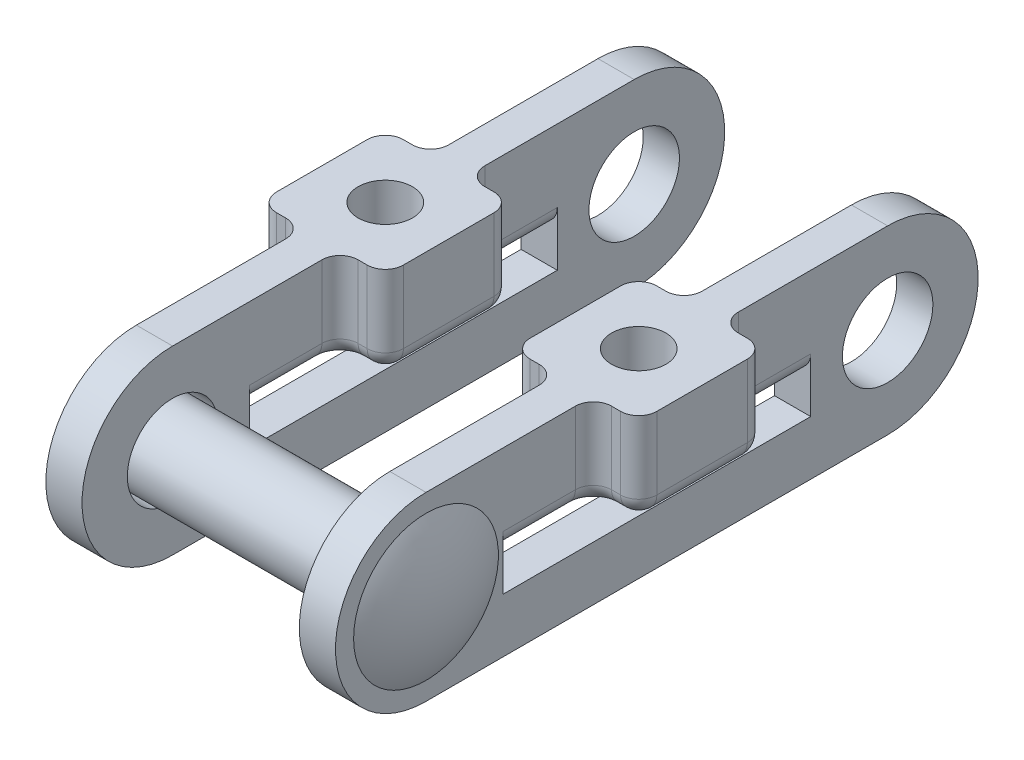
from build123d import *

# Parameters (mm, degrees)
SKETCH8_R           = 2.5
BOSS_EXTRUDE4_DEPTH = 2
SKETCH9_W           = 7
SKETCH9_H           = 7
BOSS_EXTRUDE5_DEPTH = 5
SKETCH10_R          = 1.5
CUT_EXTRUDE3_DEPTH  = 5
SKETCH11_W          = 2
SKETCH11_H          = 17
CUT_EXTRUDE4_DEPTH  = 2
FILLET3_R           = 1
LPATTERN2_COUNT     = 2
LPATTERN2_PITCH     = 14
SKETCH12_R          = 2.25
BOSS_EXTRUDE6_DEPTH = 16


with BuildPart() as part:
    # Sketch8 → Boss-Extrude4 (new body)
    with BuildSketch(Plane(origin=(0, 0, 0), x_dir=(0, 0, -1), z_dir=(1, 0, 0))):
        with BuildLine():
            Line((0, 5), (25.5, 5))
            ThreePointArc((25.5, 5), (30.5, 0), (25.5, -5))
            Line((25.5, -5), (0, -5))
            ThreePointArc((0, -5), (-5, 0), (0, 5))
        make_face()
        Circle(SKETCH8_R, mode=Mode.SUBTRACT)
        with Locations((25.5, 0)):
            Circle(SKETCH8_R, mode=Mode.SUBTRACT)
    extrude(amount=BOSS_EXTRUDE4_DEPTH)

    # Sketch9 → Boss-Extrude5 (add)
    with BuildSketch(Plane(origin=(0, 5, 0), x_dir=(1, 0, 0), z_dir=(0, 1, 0))):
        with Locations((1, 12.75)):
            Rectangle(SKETCH9_W, SKETCH9_H)
    extrude(amount=-BOSS_EXTRUDE5_DEPTH)

    # Sketch10 → Cut-Extrude3 (cut)
    with BuildSketch(Plane(origin=(0, 5, 0), x_dir=(1, 0, 0), z_dir=(0, 1, 0))):
        with Locations(Location((1, 12.75, 0), (0, 0, 270))):
            Circle(SKETCH10_R)
    extrude(amount=-CUT_EXTRUDE3_DEPTH, mode=Mode.SUBTRACT)

    # Sketch11 → Cut-Extrude4 (cut)
    with BuildSketch(Plane.XZ):
        with Locations((1, -12.75)):
            Rectangle(SKETCH11_W, SKETCH11_H)
    extrude(amount=CUT_EXTRUDE4_DEPTH, mode=Mode.SUBTRACT)

    # Fillet3
    fillet3_edges = [part.edges().sort_by_distance(p)[0] for p in [
        (2, 0, -6.75),
        (0, 0, -18.75),
        (0, 0, -6.75),
        (2, 0, -18.75),
        (3.25, 0, -16.25),
        (3.25, 0, -9.25),
        (4.5, 0, -12.75),
        (4.5, 2.5, -16.25),
        (4.5, 2.5, -9.25),
        (2, 2.5, -9.25),
        (-1.25, 0, -16.25),
        (-1.25, 0, -9.25),
        (-2.5, 0, -12.75),
        (-2.5, 2.5, -16.25),
        (-2.5, 2.5, -9.25),
        (0, 2.5, -9.25),
        (0, 2.5, -16.25),
        (2, 2.5, -16.25),
    ]]
    fillet(fillet3_edges, radius=FILLET3_R - 0.0001)  # a hair under: the kernel refuses the full size


with BuildPart() as lpattern2_1:
    # LPattern2: pattern copy
    add(part.part.moved(Location(Vector(-1, 0, 0) * (1 * LPATTERN2_PITCH))))


with BuildPart() as body_3:
    # Sketch12 → Boss-Extrude6 (new body)
    with BuildSketch(Plane(origin=(2, 0, 0), x_dir=(0, 0, -1), z_dir=(1, 0, 0))):
        Circle(SKETCH12_R)
    extrude(amount=-BOSS_EXTRUDE6_DEPTH)

    # Sketch13 → Revolve5 (revolve)
    with BuildSketch(Plane(origin=(0, 0, 0), x_dir=(1, 0, 0), z_dir=(0, 1, 0))):
        with BuildLine():
            Line((2, 0), (3, 0))
            ThreePointArc((3, 0), (2.746211251, -2.061552813), (2, -4))
            Line((2, -4), (2, 0))
        make_face()
        with BuildLine():
            Line((-14, 0), (-15, 0))
            ThreePointArc((-15, 0), (-14.746211251, -2.061552813), (-14, -4))
            Line((-14, -4), (-14, 0))
        make_face()
    revolve(axis=Axis((2, 0, 0), (1, 0, 0)))


solid = Compound([part.part, lpattern2_1.part, body_3.part])
